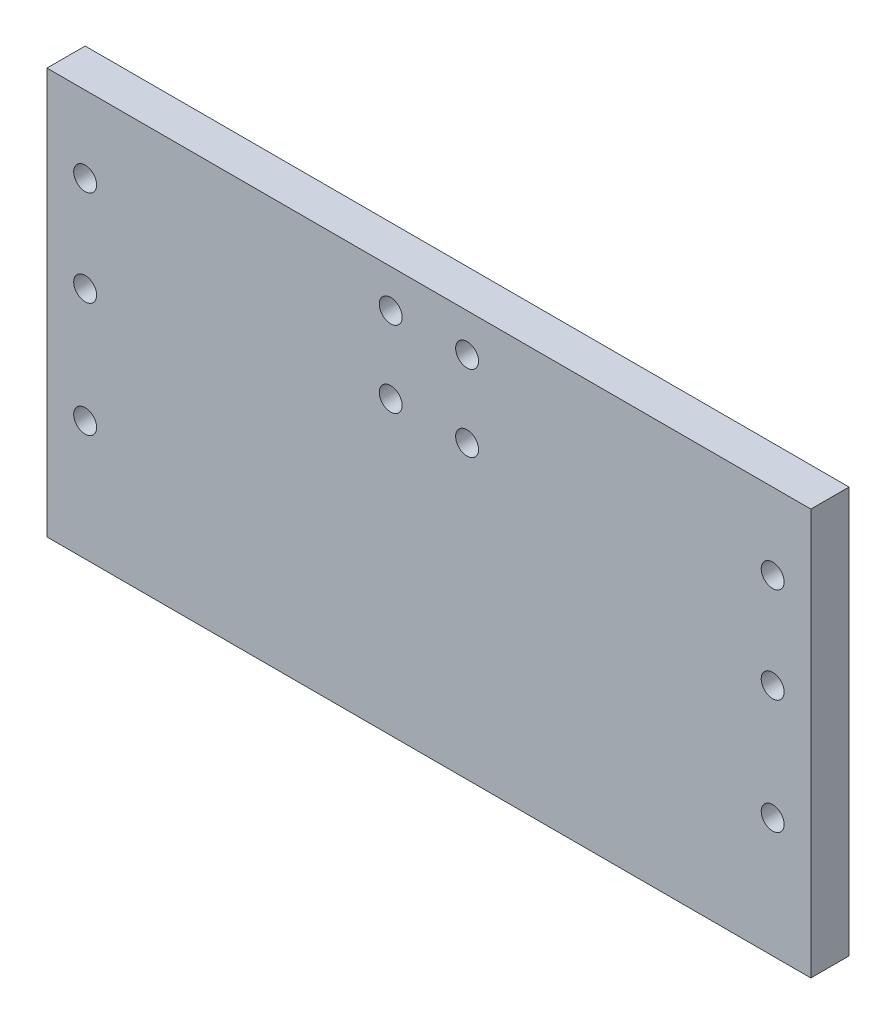
from build123d import *

# Parameters (mm, degrees)
SKETCH1_W           = 100
SKETCH1_H           = 53.16
BOSS_EXTRUDE1_DEPTH = 5
SKETCH2_R           = 1.5
CUT_EXTRUDE1_DEPTH  = 57.846252295


with BuildPart() as part:
    # Sketch1 → Boss-Extrude1 (new body)
    with BuildSketch(Plane.XY):
        Rectangle(SKETCH1_W, SKETCH1_H)
    extrude(amount=BOSS_EXTRUDE1_DEPTH)

    # Sketch2 → Cut-Extrude1 (cut, through all)
    with BuildSketch(Plane.XY.offset(5)):
        with Locations((-45, 16.58)):
            Circle(SKETCH2_R)
        with Locations((-45, 4.08)):
            Circle(SKETCH2_R)
        with Locations((-45, -10.92)):
            Circle(SKETCH2_R)
        with Locations((45, -10.92)):
            Circle(SKETCH2_R)
        with Locations((45, 4.08)):
            Circle(SKETCH2_R)
        with Locations((45, 16.58)):
            Circle(SKETCH2_R)
        with Locations((-5, 11.58)):
            Circle(SKETCH2_R)
        with Locations((-5, 21.58)):
            Circle(SKETCH2_R)
        with Locations((5, 11.58)):
            Circle(SKETCH2_R)
        with Locations((5, 21.58)):
            Circle(SKETCH2_R)
    extrude(amount=-CUT_EXTRUDE1_DEPTH, mode=Mode.SUBTRACT)


solid = part.part
